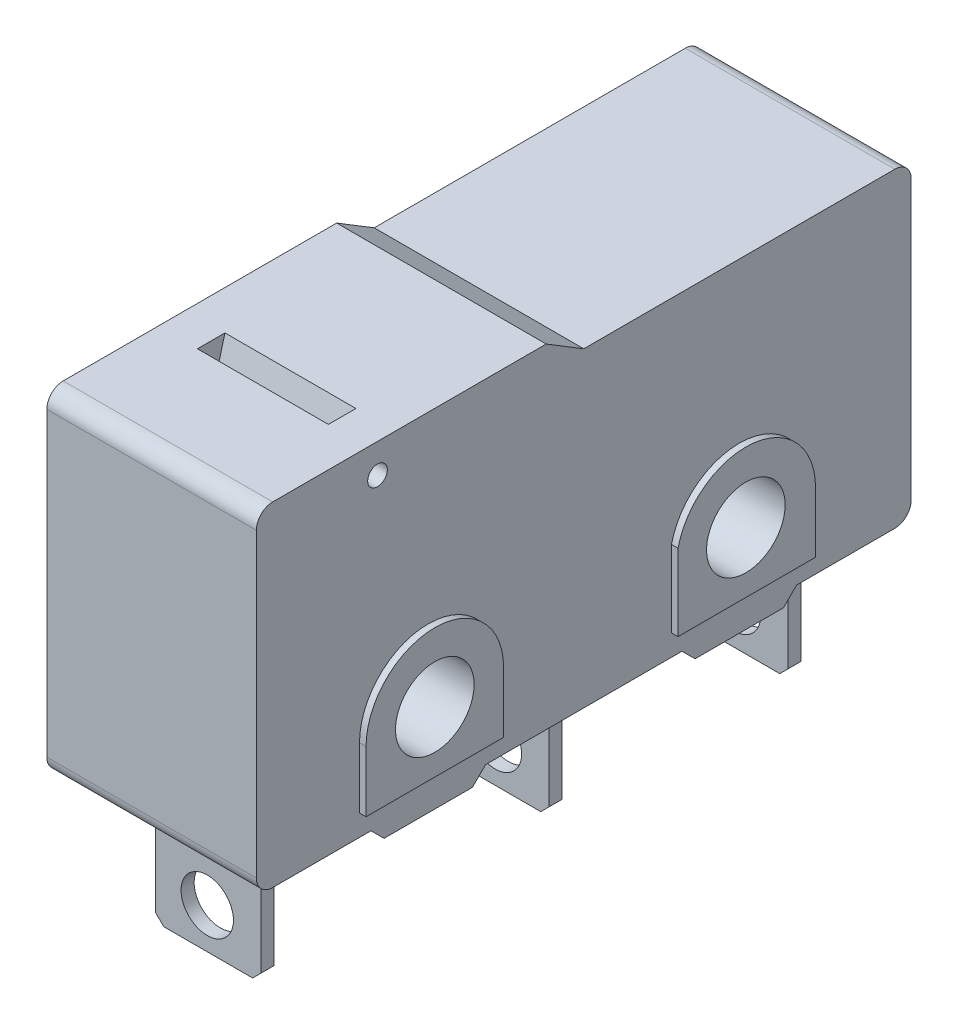
from build123d import *

# Parameters (mm, degrees)
BOSS_EXTRUDE1_DEPTH      = 3.2
SKETCH5_W                = 3.213765407
SKETCH5_H                = 0.4
BOSS_EXTRUDE2_DEPTH      = 3.9
CHAMFER2_SIZE            = 0.25
SKETCH6_R                = 0.8
CUT_EXTRUDE1_DEPTH       = 21.642916461
FILLET1_R                = 0.5
SKETCH7_R                = 1.2
CUT_EXTRUDE2_DEPTH       = 15.898322053
BOSS_EXTRUDE5_DEPTH      = 3.4
BOSS_EXTRUDE5_DEPTH_BACK = 3.4
SKETCH11_R               = 1.2
SKETCH12_R               = 0.3
CUT_EXTRUDE3_DEPTH       = 15.985326156
CUT_EXTRUDE4_DEPTH       = 2
CUT_EXTRUDE4_DEPTH_BACK  = 2


with BuildPart() as part:
    # Sketch1 → Boss-Extrude1 (new, symmetric)
    with BuildSketch(Plane(origin=(0, 0, 0), x_dir=(0, 0, -1), z_dir=(1, 0, 0))):
        Polygon((10, 4.4), (0, 4.4), (-1.147622848, 5.1), (-10, 5.1), (-10, -5.1), (-6.5, -5.1), (-6.1, -5.5), (-3.4, -5.5), (-3, -5.1), (3, -5.1), (3.4, -5.5), (6.1, -5.5), (6.5, -5.1), (10, -5.1), align=None)
    extrude(amount=BOSS_EXTRUDE1_DEPTH, both=True)

    # Sketch5 → Boss-Extrude2 (add)
    with BuildSketch(Plane.XZ.offset(5.1)):
        with Locations((0.02921605, 8.1)):
            Rectangle(SKETCH5_W, SKETCH5_H)
        with Locations((0.02921605, -0.7)):
            Rectangle(SKETCH5_W, SKETCH5_H)
        with Locations((0.02921605, -8)):
            Rectangle(SKETCH5_W, SKETCH5_H)
    extrude(amount=BOSS_EXTRUDE2_DEPTH)

    # Chamfer2
    chamfer2_edges = [part.edges().sort_by_distance(p)[0] for p in [
        (-1.577666654, -9, 8.1),
        (1.636098753, -9, -8),
        (-1.577666654, -9, -8),
        (1.636098753, -9, -0.7),
        (-1.577666654, -9, -0.7),
        (1.636098753, -9, 8.1),
    ]]
    chamfer(chamfer2_edges, length=CHAMFER2_SIZE)

    # Sketch6 → Cut-Extrude1 (cut, through all)
    with BuildSketch(Plane.XY.offset(8.3)):
        with Locations((0, -7.76874139)):
            Circle(SKETCH6_R)
    extrude(amount=-CUT_EXTRUDE1_DEPTH, mode=Mode.SUBTRACT)

    # Fillet1
    fillet1_edges = [part.edges().sort_by_distance(p)[0] for p in [
        (0, -5.1, -10),
        (0, 4.4, -10),
        (0, -5.1, 10),
        (0, 5.1, 10),
    ]]
    fillet(fillet1_edges, radius=FILLET1_R)

    # Sketch7 → Cut-Extrude2 (cut, through all)
    with BuildSketch(Plane(origin=(3.2, 0, 0), x_dir=(0, 0, -1), z_dir=(1, 0, 0))):
        with Locations((-4.75, -2.6)):
            Circle(SKETCH7_R)
        with Locations((4.75, -2.6)):
            Circle(SKETCH7_R)
    extrude(amount=-CUT_EXTRUDE2_DEPTH, mode=Mode.SUBTRACT)

    # Sketch11 → Boss-Extrude5 (add, two sides: drawn at the far end of the back side and taken through both)
    # profile 1 of 2: a face of its own
    with BuildSketch(Plane(origin=(0, 0, 0), x_dir=(0, 0, -1), z_dir=(1, 0, 0)).offset(-BOSS_EXTRUDE5_DEPTH_BACK)):
        with BuildLine():
            Line((-6.85, -4.453368072), (-2.65, -4.453368072))
            Line((-2.65, -4.453368072), (-2.65, -2.6))
            ThreePointArc((-2.65, -2.6), (-4.75, -0.5), (-6.85, -2.6))
            Line((-6.85, -2.6), (-6.85, -4.453368072))
        make_face()
        with Locations((-4.75, -2.6)):
            Circle(SKETCH11_R, mode=Mode.SUBTRACT)
    # profile 2 of 2: a face of its own
    with BuildSketch(Plane(origin=(0, 0, 0), x_dir=(0, 0, -1), z_dir=(1, 0, 0)).offset(-BOSS_EXTRUDE5_DEPTH_BACK)):
        with BuildLine():
            Line((2.678191921, -4.453368072), (6.878191921, -4.453368072))
            Line((6.878191921, -4.453368072), (6.878191921, -2.6))
            ThreePointArc((6.878191921, -2.6), (4.994944522, -0.485951033), (2.678191921, -2.113366526))
            Line((2.678191921, -2.113366526), (2.678191921, -4.453368072))
        make_face()
        with Locations((4.75, -2.6)):
            Circle(SKETCH11_R, mode=Mode.SUBTRACT)
    extrude(amount=BOSS_EXTRUDE5_DEPTH + BOSS_EXTRUDE5_DEPTH_BACK)

    # Sketch12 → Cut-Extrude3 (cut, through all)
    with BuildSketch(Plane(origin=(3.2, 0, 0), x_dir=(0, 0, -1), z_dir=(1, 0, 0))):
        with Locations((-6.3, 4.201970351)):
            Circle(SKETCH12_R)
    extrude(amount=-CUT_EXTRUDE3_DEPTH, mode=Mode.SUBTRACT)

    # Sketch13 → Cut-Extrude4 (cut, two sides: drawn at the far end of the back side and taken through both)
    with BuildSketch(Plane(origin=(0, 0, 0), x_dir=(0, 0, -1), z_dir=(1, 0, 0)).offset(-CUT_EXTRUDE4_DEPTH_BACK)):
        Polygon((-6.6, 4.201970351), (-6.6, 5.1), (-5.759373681, 5.1), (-6, 4.201970351), align=None)
    extrude(amount=CUT_EXTRUDE4_DEPTH + CUT_EXTRUDE4_DEPTH_BACK, mode=Mode.SUBTRACT)


solid = part.part
